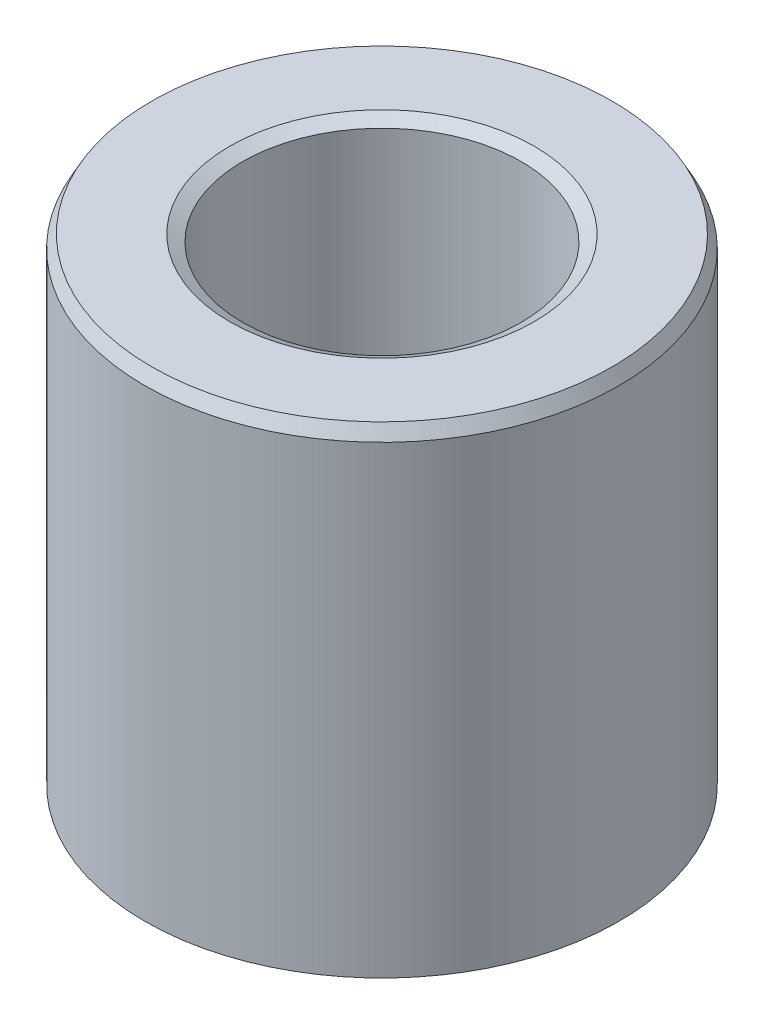
from build123d import *
from OCP.BRepFilletAPI import BRepFilletAPI_MakeChamfer

# Parameters (mm, degrees)
SKETCH1_R           = 22.5
BOSS_EXTRUDE1_DEPTH = 45.892957767
SKETCH2_R           = 13.220716088
CUT_EXTRUDE1_DEPTH  = 56.84499595
CHAMFER1_SIZE       = 1.215812547
CHAMFER1_SIZE2      = 0.657686703


with BuildPart() as part:
    # Sketch1 → Boss-Extrude1 (new body)
    with BuildSketch(Plane(origin=(0, 0, 0), x_dir=(1, 0, 0), z_dir=(0, 1, 0))):
        Circle(SKETCH1_R)
    extrude(amount=BOSS_EXTRUDE1_DEPTH)

    # Sketch2 → Cut-Extrude1 (cut, through all)
    with BuildSketch(Plane(origin=(0, 0, 0), x_dir=(1, 0, 0), z_dir=(0, 1, 0))):
        Circle(SKETCH2_R)
    extrude(amount=CUT_EXTRUDE1_DEPTH, mode=Mode.SUBTRACT)

    # Chamfer1: one chamfer whose edges measure the first distance from different faces: ONE call of the kernel's chamfer builder (chamfer() names one face for all edges)
    chamfer1_edges_1 = [part.edges().sort_by_distance(p)[0] for p in [
        (-13.220716088, 45.892957767, 0),
    ]]
    chamfer1_side_1 = [part.faces().sort_by_distance(p)[0] for p in [
        (-21.863603897, 45.892957767, 0),
    ]]
    chamfer1_edges_2 = [part.edges().sort_by_distance(p)[0] for p in [
        (-13.220716088, 0, 0),
    ]]
    chamfer1_side_2 = [part.faces().sort_by_distance(p)[0] for p in [
        (-13.220716088, 22.946478884, 0),
    ]]
    chamfer1_edges_3 = [part.edges().sort_by_distance(p)[0] for p in [
        (-22.5, 0, 0),
    ]]
    chamfer1_side_3 = [part.faces().sort_by_distance(p)[0] for p in [
        (-21.863603897, 0, 0),
    ]]
    chamfer1_edges_4 = [part.edges().sort_by_distance(p)[0] for p in [
        (-22.5, 45.892957767, 0),
    ]]
    chamfer1_side_4 = [part.faces().sort_by_distance(p)[0] for p in [
        (-22.5, 22.946478884, 0),
    ]]
    chamfer1 = BRepFilletAPI_MakeChamfer(part.part.solid().wrapped)
    for e in chamfer1_edges_1:
        chamfer1.Add(CHAMFER1_SIZE, CHAMFER1_SIZE2, e.wrapped, chamfer1_side_1[0].wrapped)  # the first distance lies on this face
    for e in chamfer1_edges_2:
        chamfer1.Add(CHAMFER1_SIZE, CHAMFER1_SIZE2, e.wrapped, chamfer1_side_2[0].wrapped)  # the first distance lies on this face
    for e in chamfer1_edges_3:
        chamfer1.Add(CHAMFER1_SIZE, CHAMFER1_SIZE2, e.wrapped, chamfer1_side_3[0].wrapped)  # the first distance lies on this face
    for e in chamfer1_edges_4:
        chamfer1.Add(CHAMFER1_SIZE, CHAMFER1_SIZE2, e.wrapped, chamfer1_side_4[0].wrapped)  # the first distance lies on this face
    add(Compound.cast(chamfer1.Shape()), mode=Mode.REPLACE)


solid = part.part
